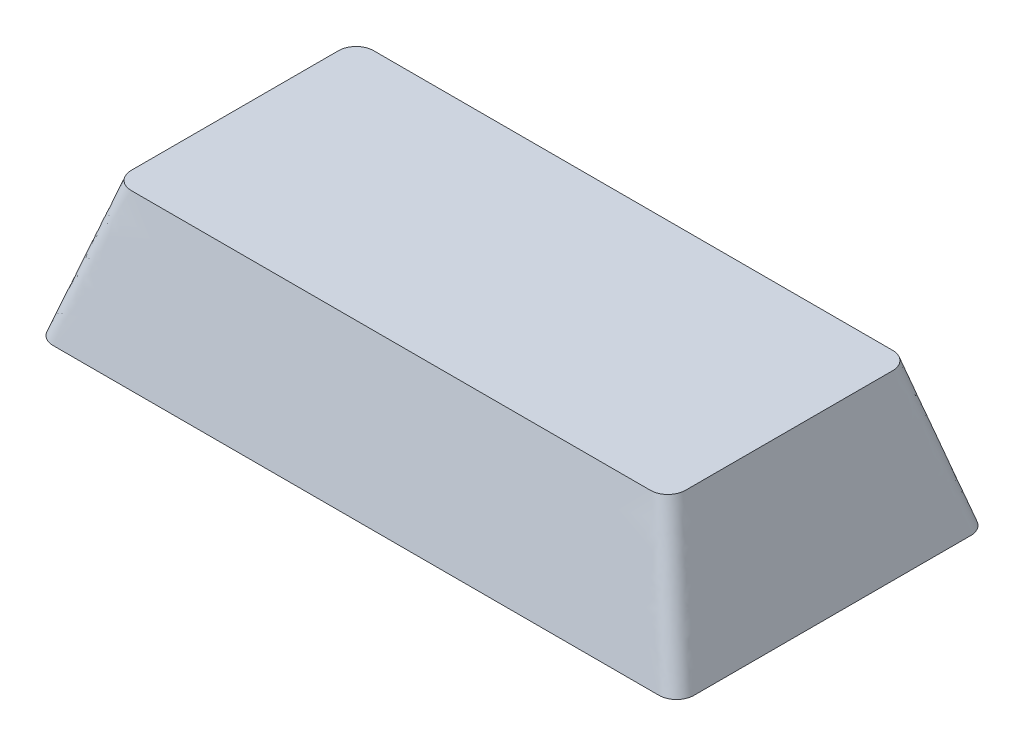
from build123d import *


with BuildPart() as part:
    # Croquis3 for Recubrir1 → Recubrir1 section 0
    with BuildSketch(Plane(origin=(0, 8.001, 0), x_dir=(1, 0, 0), z_dir=(0, 1, 0))):
        with BuildLine():
            Line((-14.986, -6.9977), (14.986, -6.9977))
            # circular arc as an exact rational Bezier (weights 1, cos(half-angle), 1)
            Bezier((14.986, -6.9977), (16.002, -6.9977), (16.002, -5.9817), weights=[1, 0.707106781, 1])
            Line((16.002, -5.9817), (16.002, 5.9817))
            Bezier((16.002, 5.9817), (16.002, 6.9977), (14.986, 6.9977), weights=[1, 0.707106781, 1])
            Line((14.986, 6.9977), (-14.986, 6.9977))
            Bezier((-14.986, 6.9977), (-16.002, 6.9977), (-16.002, 5.9817), weights=[1, 0.707106781, 1])
            Line((-16.002, 5.9817), (-16.002, -5.9817))
            Bezier((-16.002, -5.9817), (-16.002, -6.9977), (-14.986, -6.9977), weights=[1, 0.707106781, 1])
        make_face()
    # Croquis2 for Recubrir1 → Recubrir1 section 1
    with BuildSketch(Plane(origin=(0, 0, 0), x_dir=(1, 0, 0), z_dir=(0, 1, 0))):
        with BuildLine():
            Line((-17.4879, -9.0043), (17.4879, -9.0043))
            Bezier((17.4879, -9.0043), (18.5039, -9.0043), (18.5039, -7.9883), weights=[1, 0.707106781, 1])
            Line((18.5039, -7.9883), (18.5039, 7.9883))
            Bezier((18.5039, 7.9883), (18.5039, 9.0043), (17.4879, 9.0043), weights=[1, 0.707106781, 1])
            Line((17.4879, 9.0043), (-17.4879, 9.0043))
            Bezier((-17.4879, 9.0043), (-18.5039, 9.0043), (-18.5039, 7.9883), weights=[1, 0.707106781, 1])
            Line((-18.5039, 7.9883), (-18.5039, -7.9883))
            Bezier((-18.5039, -7.9883), (-18.5039, -9.0043), (-17.4879, -9.0043), weights=[1, 0.707106781, 1])
        make_face()
    loft()


solid = part.part
